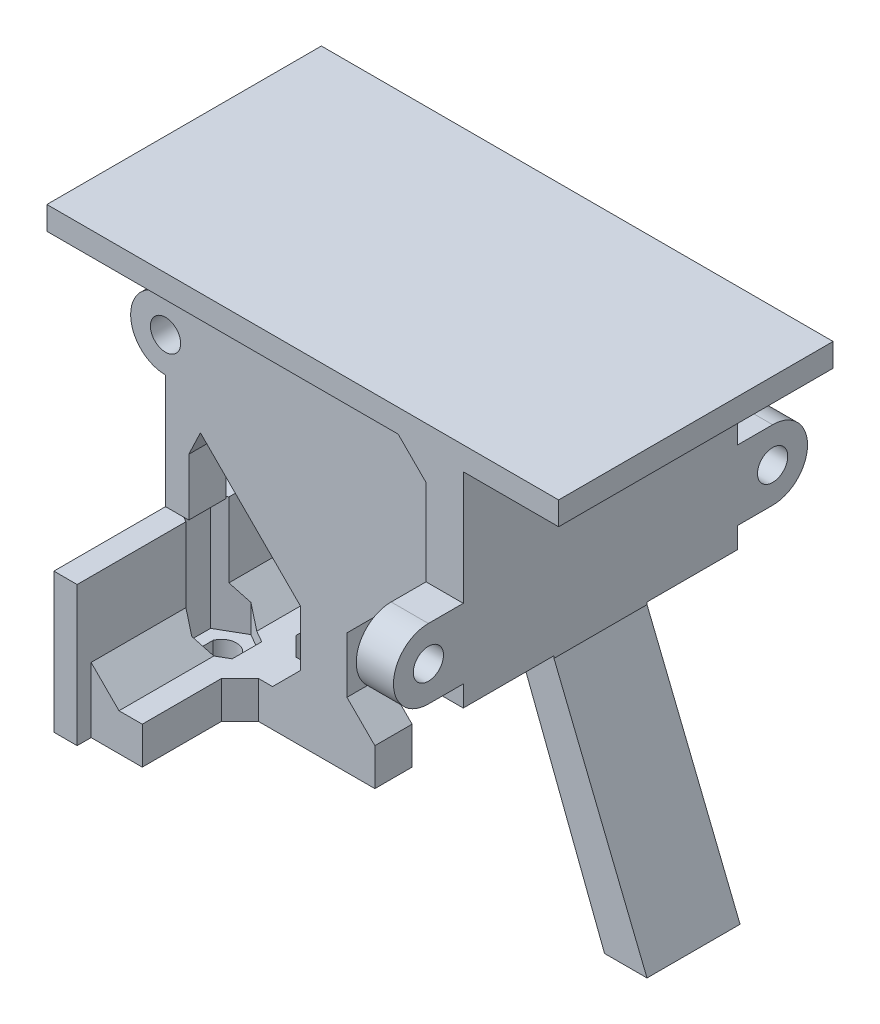
from build123d import *

# Parameters (mm, degrees)
CROQUIS1_R                   = 1.625
SALIENTE_EXTRUIR1_DEPTH      = 4
CROQUIS2_W                   = 5
CROQUIS2_H                   = 25
SALIENTE_EXTRUIR2_DEPTH      = 4
CROQUIS3_R                   = 1.625
SALIENTE_EXTRUIR3_DEPTH      = 4
CHAFL_N1_SIZE                = 3
CHAFL_N2_SIZE                = 1.5
SALIENTE_EXTRUIR4_DEPTH      = 21
SALIENTE_EXTRUIR4_DEPTH_BACK = 25
CROQUIS4_W                   = 7.75
CROQUIS4_H                   = 12
CORTAR_EXTRUIR1_DEPTH        = 52.798286651
CORTAR_EXTRUIR1_DEPTH_BACK   = 52.798286651
CROQUIS5_W                   = 3.75
CROQUIS5_H                   = 21
CORTAR_EXTRUIR2_DEPTH        = 48.697615244
CORTAR_EXTRUIR2_DEPTH_BACK   = 48.697615244
CROQUIS6_R                   = 1.625
CHAFL_N4_SIZE                = 5
CROQUIS7_R                   = 3.745
CORTAR_EXTRUIR5_DEPTH        = 22
CORTAR_EXTRUIR6_START        = 22
CROQUIS8_R                   = 3.745
CORTAR_EXTRUIR6_DEPTH        = 22
CORTAR_EXTRUIR7_DEPTH        = 22
CROQUIS10_R                  = 1.625
CORTAR_EXTRUIR8_DEPTH        = 22
CHAFL_N5_SIZE                = 12
CROQUIS11_W                  = 2.5
CROQUIS11_H                  = 28
SALIENTE_EXTRUIR5_DEPTH      = 15
CHAFL_N6_SIZE                = 3
CORTAR_EXTRUIR9_REACH        = 55.94
CORTAR_EXTRUIR9_START        = -2.5
CORTAR_EXTRUIR10_DEPTH       = 10
SALIENTE_EXTRUIR6_DEPTH      = 10
SALIENTE_EXTRUIR6_DEPTH_BACK = 8
CROQUIS14_W                  = 10
CROQUIS14_H                  = 25
CROQUIS15_W                  = 29.5
CROQUIS15_H                  = 4
CROQUIS15_W_2                = 4
CROQUIS15_H_2                = 29.5
SALIENTE_EXTRUIR7_DEPTH      = 10
CROQUIS16_W                  = 55
CROQUIS16_H                  = 29.5
SALIENTE_EXTRUIR8_DEPTH      = 2.5
CHAFL_N7_SIZE                = 3
SALIENTE_EXTRUIR9_DEPTH      = 4
CHAFL_N11_SIZE               = 3
CHAFL_N12_SIZE               = 10.100655646
CHAFL_N12_SIZE_2             = 25
CHAFL_N14_SIZE               = 35
CHAFL_N14_SIZE_2             = 13.435241226


# Some blends are built 0.0001 mm under size
with BuildPart() as part:
    # Croquis1 → Saliente-Extruir1 (new body)
    with BuildSketch(Plane.XY):
        with BuildLine():
            Line((-14.75, 6), (-14.75, 3.75))
            Line((-14.75, 3.75), (-18.5, 3.75))
            ThreePointArc((-18.5, 3.75), (-22.25, 0), (-18.5, -3.75))
            Line((-18.5, -3.75), (-14.75, -3.75))
            Line((-14.75, -3.75), (-14.75, -6))
            Line((-14.75, -6), (14.75, -6))
            Line((14.75, -6), (14.75, -3.75))
            Line((14.75, -3.75), (18.5, -3.75))
            ThreePointArc((18.5, -3.75), (22.25, 0), (18.5, 3.75))
            Line((18.5, 3.75), (14.75, 3.75))
            Line((14.75, 3.75), (14.75, 6))
            Line((14.75, 6), (-14.75, 6))
        make_face()
        with Locations((-18.5, 0)):
            Circle(CROQUIS1_R, mode=Mode.SUBTRACT)
        with Locations((18.5, 0)):
            Circle(CROQUIS1_R, mode=Mode.SUBTRACT)
    extrude(amount=SALIENTE_EXTRUIR1_DEPTH)

    # Croquis2 → Saliente-Extruir2 (add)
    with BuildSketch(Plane.XY.offset(4)):
        with Locations((-1.5, -18.5)):
            Rectangle(CROQUIS2_W, CROQUIS2_H)
    extrude(amount=-SALIENTE_EXTRUIR2_DEPTH)

    # Croquis3 → Saliente-Extruir3 (add)
    with BuildSketch(Plane.XZ.offset(31)):
        Polygon((-10.5, -1.5), (-10.5, -10.5), (-18.5, -10.5), (-18.5, 14.5), (-10.5, 14.5), (-10.5, 5.5), (4, 5.5), (4, -1.5), align=None)
        with Locations(Location((-14.5, 2, 0), (0, 0, 270))):
            Circle(CROQUIS3_R, mode=Mode.SUBTRACT)
    extrude(amount=-SALIENTE_EXTRUIR3_DEPTH)

    # Chaflán1
    chafl_n1_edges = [part.edges().sort_by_distance(p)[0] for p in [
        (-4, -27, 2),
    ]]
    chamfer(chafl_n1_edges, length=CHAFL_N1_SIZE)

    # Chaflán2
    chafl_n2_edges = [part.edges().sort_by_distance(p)[0] for p in [
        (-10.5, -29, -1.5),
        (-10.5, -29, 5.5),
    ]]
    chamfer(chafl_n2_edges, length=CHAFL_N2_SIZE)

    # Croquis4 → Saliente-Extruir4 (add, two sides: drawn at the far end of the back side and taken through both)
    with BuildSketch(Plane.XY.offset(4).offset(-SALIENTE_EXTRUIR4_DEPTH_BACK)):
        with Locations((22.375, 0)):
            Rectangle(CROQUIS4_W, CROQUIS4_H)
    extrude(amount=SALIENTE_EXTRUIR4_DEPTH + SALIENTE_EXTRUIR4_DEPTH_BACK)

    # Croquis5 → Cortar-Extruir1 (cut, two sides: drawn at the far end of the back side and taken through both)
    with BuildSketch(Plane(origin=(0, 6, 0), x_dir=(1, 0, 0), z_dir=(0, 1, 0)).offset(-CORTAR_EXTRUIR1_DEPTH_BACK)):
        with Locations((20.375, 10.5)):
            Rectangle(CROQUIS5_W, CROQUIS5_H)
        with Locations((20.375, -14.5)):
            Rectangle(CROQUIS5_W, CROQUIS5_H)
    extrude(amount=CORTAR_EXTRUIR1_DEPTH + CORTAR_EXTRUIR1_DEPTH_BACK, mode=Mode.SUBTRACT)

    # Croquis6 → Cortar-Extruir2 (cut, two sides: drawn at the far end of the back side and taken through both)
    with BuildSketch(Plane.XY.offset(4).offset(-CORTAR_EXTRUIR2_DEPTH_BACK)):
        with Locations((18.5, 0)):
            Circle(CROQUIS6_R)
        Polygon((18.5, 3.75), (22.25, 6), (18.5, 6), align=None)
        Polygon((18.5, -3.75), (22.25, -6), (18.5, -6), align=None)
    extrude(amount=CORTAR_EXTRUIR2_DEPTH + CORTAR_EXTRUIR2_DEPTH_BACK, mode=Mode.SUBTRACT)

    # Chaflán4
    # the kernel refuses this chamfer: 5 mm, written as the material it adds along each edge
    with BuildSketch(Plane(origin=(22.25, -6, 0), x_dir=(-0.9996219169112968, 0, 0.027495876610586372), z_dir=(0, 1, 0))) as chafl_n4_piece_1_section:
        Polygon((CHAFL_N4_SIZE * 0.999621916911, -CHAFL_N4_SIZE * 0.0274958766106), (-CHAFL_N4_SIZE * 0.0274958766106, -CHAFL_N4_SIZE * 0.999621916911), (0, 0), align=None)
    chafl_n4_piece_1 = extrude(amount=12, mode=Mode.PRIVATE)
    chafl_n4_piece_1 = split(chafl_n4_piece_1, bisect_by=Plane(origin=(20.922110661, -5.203266397, -2.017665357), z_dir=(0.5144957554275262, 0.8574929257125444, 0)), keep=Keep.TOP, mode=Mode.PRIVATE)
    chafl_n4_piece_1 = split(chafl_n4_piece_1, bisect_by=Plane(origin=(21.29244932, -3.75, -2.017665357), z_dir=(0, -1, 0)), keep=Keep.TOP, mode=Mode.PRIVATE)
    add(chafl_n4_piece_1)
    with BuildSketch(Plane(origin=(22.25, -6, 0), x_dir=(-0.9996219169112968, 0, 0.027495876610586372), z_dir=(0, 1, 0))) as chafl_n4_piece_2_section:
        Polygon((CHAFL_N4_SIZE * 0.999621916911, -CHAFL_N4_SIZE * 0.0274958766106), (-CHAFL_N4_SIZE * 0.0274958766106, -CHAFL_N4_SIZE * 0.999621916911), (0, 0), align=None)
    chafl_n4_piece_2 = extrude(amount=12, mode=Mode.PRIVATE)
    chafl_n4_piece_2 = split(chafl_n4_piece_2, bisect_by=Plane(origin=(17.859122077, -3.365473246, -0.159071565), z_dir=(-0.5144957554275262, -0.8574929257125444, 0)), keep=Keep.TOP, mode=Mode.PRIVATE)
    chafl_n4_piece_2 = split(chafl_n4_piece_2, bisect_by=Plane(origin=(17.761361038, -3.75, -0.159071565), z_dir=(0, 1, 0)), keep=Keep.TOP, mode=Mode.PRIVATE)
    add(chafl_n4_piece_2)
    with BuildSketch(Plane(origin=(22.25, -6, 0), x_dir=(-0.9996219169112968, 0, 0.027495876610586372), z_dir=(0, 1, 0))) as chafl_n4_piece_3_section:
        Polygon((CHAFL_N4_SIZE * 0.999621916911, -CHAFL_N4_SIZE * 0.0274958766106), (-CHAFL_N4_SIZE * 0.0274958766106, -CHAFL_N4_SIZE * 0.999621916911), (0, 0), align=None)
    chafl_n4_piece_3 = extrude(amount=12, mode=Mode.PRIVATE)
    chafl_n4_piece_3 = split(chafl_n4_piece_3, bisect_by=Plane(origin=(20.83228479, 3.75, -1.77005128), z_dir=(0, -1, 0)), keep=Keep.TOP, mode=Mode.PRIVATE)
    chafl_n4_piece_3 = split(chafl_n4_piece_3, bisect_by=Plane(origin=(18.560503744, 3.786302247, -1.77005128), z_dir=(0.5144957554275259, -0.8574929257125447, 0)), keep=Keep.TOP, mode=Mode.PRIVATE)
    chafl_n4_piece_3 = split(chafl_n4_piece_3, bisect_by=Plane(origin=(18.560503299, -3.786301979, -1.77005128), z_dir=(0.5144957554275262, 0.8574929257125444, 0)), keep=Keep.TOP, mode=Mode.PRIVATE)
    chafl_n4_piece_3 = split(chafl_n4_piece_3, bisect_by=Plane(origin=(20.83228479, -3.75, -1.77005128), z_dir=(0, 1, 0)), keep=Keep.TOP, mode=Mode.PRIVATE)
    chafl_n4_piece_3 = chafl_n4_piece_3 - Plane(origin=(18.5, 0, -1.77005128), x_dir=(1, 0, 0), z_dir=(0, 0, -1)) * Cylinder(1.625, 44, mode=Mode.PRIVATE)
    add(chafl_n4_piece_3)
    with BuildSketch(Plane(origin=(22.25, -6, 0), x_dir=(-0.9996219169112968, 0, 0.027495876610586372), z_dir=(0, 1, 0))) as chafl_n4_piece_4_section:
        Polygon((CHAFL_N4_SIZE * 0.999621916911, -CHAFL_N4_SIZE * 0.0274958766106), (-CHAFL_N4_SIZE * 0.0274958766106, -CHAFL_N4_SIZE * 0.999621916911), (0, 0), align=None)
    chafl_n4_piece_4 = extrude(amount=12, mode=Mode.PRIVATE)
    chafl_n4_piece_4 = split(chafl_n4_piece_4, bisect_by=Plane(origin=(21.29244932, 3.75, -2.017665357), z_dir=(0, 1, 0)), keep=Keep.TOP, mode=Mode.PRIVATE)
    chafl_n4_piece_4 = split(chafl_n4_piece_4, bisect_by=Plane(origin=(20.922110661, 5.203266397, -2.017665357), z_dir=(0.5144957554275259, -0.8574929257125447, 0)), keep=Keep.TOP, mode=Mode.PRIVATE)
    add(chafl_n4_piece_4)
    with BuildSketch(Plane(origin=(22.25, -6, 0), x_dir=(-0.9996219169112968, 0, 0.027495876610586372), z_dir=(0, 1, 0))) as chafl_n4_piece_5_section:
        Polygon((CHAFL_N4_SIZE * 0.999621916911, -CHAFL_N4_SIZE * 0.0274958766106), (-CHAFL_N4_SIZE * 0.0274958766106, -CHAFL_N4_SIZE * 0.999621916911), (0, 0), align=None)
    chafl_n4_piece_5 = extrude(amount=12, mode=Mode.PRIVATE)
    chafl_n4_piece_5 = split(chafl_n4_piece_5, bisect_by=Plane(origin=(17.761361038, 3.75, -0.159071565), z_dir=(0, -1, 0)), keep=Keep.TOP, mode=Mode.PRIVATE)
    chafl_n4_piece_5 = split(chafl_n4_piece_5, bisect_by=Plane(origin=(17.859122077, 3.365473246, -0.159071565), z_dir=(-0.5144957554275259, 0.8574929257125447, 0)), keep=Keep.TOP, mode=Mode.PRIVATE)
    add(chafl_n4_piece_5)
    with BuildSketch(Plane(origin=(22.25, 6, 4), x_dir=(-0.9996219169112968, 0, -0.027495876610586403), z_dir=(0, -1, 0))) as chafl_n4_piece_6_section:
        Polygon((CHAFL_N4_SIZE * 0.999621916911, -CHAFL_N4_SIZE * 0.0274958766106), (-CHAFL_N4_SIZE * 0.0274958766106, -CHAFL_N4_SIZE * 0.999621916911), (0, 0), align=None)
    chafl_n4_piece_6 = extrude(amount=12, mode=Mode.PRIVATE)
    chafl_n4_piece_6 = split(chafl_n4_piece_6, bisect_by=Plane(origin=(21.29244932, 3.75, 6.017665357), z_dir=(0, 1, 0)), keep=Keep.TOP, mode=Mode.PRIVATE)
    chafl_n4_piece_6 = split(chafl_n4_piece_6, bisect_by=Plane(origin=(20.922110661, 5.203266397, 6.017665357), z_dir=(0.5144957554275259, -0.8574929257125447, 0)), keep=Keep.TOP, mode=Mode.PRIVATE)
    add(chafl_n4_piece_6)
    with BuildSketch(Plane(origin=(22.25, 6, 4), x_dir=(-0.9996219169112968, 0, -0.027495876610586403), z_dir=(0, -1, 0))) as chafl_n4_piece_7_section:
        Polygon((CHAFL_N4_SIZE * 0.999621916911, -CHAFL_N4_SIZE * 0.0274958766106), (-CHAFL_N4_SIZE * 0.0274958766106, -CHAFL_N4_SIZE * 0.999621916911), (0, 0), align=None)
    chafl_n4_piece_7 = extrude(amount=12, mode=Mode.PRIVATE)
    chafl_n4_piece_7 = split(chafl_n4_piece_7, bisect_by=Plane(origin=(17.761361038, 3.75, 4.159071565), z_dir=(0, -1, 0)), keep=Keep.TOP, mode=Mode.PRIVATE)
    chafl_n4_piece_7 = split(chafl_n4_piece_7, bisect_by=Plane(origin=(17.859122077, 3.365473246, 4.159071565), z_dir=(-0.5144957554275259, 0.8574929257125447, 0)), keep=Keep.TOP, mode=Mode.PRIVATE)
    add(chafl_n4_piece_7)
    with BuildSketch(Plane(origin=(22.25, 6, 4), x_dir=(-0.9996219169112968, 0, -0.027495876610586403), z_dir=(0, -1, 0))) as chafl_n4_piece_8_section:
        Polygon((CHAFL_N4_SIZE * 0.999621916911, -CHAFL_N4_SIZE * 0.0274958766106), (-CHAFL_N4_SIZE * 0.0274958766106, -CHAFL_N4_SIZE * 0.999621916911), (0, 0), align=None)
    chafl_n4_piece_8 = extrude(amount=12, mode=Mode.PRIVATE)
    chafl_n4_piece_8 = split(chafl_n4_piece_8, bisect_by=Plane(origin=(20.832284794, 3.75, 5.770051284), z_dir=(0, -1, 0)), keep=Keep.TOP, mode=Mode.PRIVATE)
    chafl_n4_piece_8 = split(chafl_n4_piece_8, bisect_by=Plane(origin=(18.560503747, 3.786302248, 5.770051284), z_dir=(0.5144957554275259, -0.8574929257125447, 0)), keep=Keep.TOP, mode=Mode.PRIVATE)
    chafl_n4_piece_8 = split(chafl_n4_piece_8, bisect_by=Plane(origin=(18.560503303, -3.786301982, 5.770051284), z_dir=(0.5144957554275262, 0.8574929257125444, 0)), keep=Keep.TOP, mode=Mode.PRIVATE)
    chafl_n4_piece_8 = split(chafl_n4_piece_8, bisect_by=Plane(origin=(20.832284794, -3.75, 5.770051284), z_dir=(0, 1, 0)), keep=Keep.TOP, mode=Mode.PRIVATE)
    chafl_n4_piece_8 = chafl_n4_piece_8 - Plane(origin=(18.5, 0, 5.770051284), x_dir=(1, 0, 0), z_dir=(0, 0, -1)) * Cylinder(1.625, 44, mode=Mode.PRIVATE)
    add(chafl_n4_piece_8)
    with BuildSketch(Plane(origin=(22.25, 6, 4), x_dir=(-0.9996219169112968, 0, -0.027495876610586403), z_dir=(0, -1, 0))) as chafl_n4_piece_9_section:
        Polygon((CHAFL_N4_SIZE * 0.999621916911, -CHAFL_N4_SIZE * 0.0274958766106), (-CHAFL_N4_SIZE * 0.0274958766106, -CHAFL_N4_SIZE * 0.999621916911), (0, 0), align=None)
    chafl_n4_piece_9 = extrude(amount=12, mode=Mode.PRIVATE)
    chafl_n4_piece_9 = split(chafl_n4_piece_9, bisect_by=Plane(origin=(20.922110661, -5.203266397, 6.017665357), z_dir=(0.5144957554275262, 0.8574929257125444, 0)), keep=Keep.TOP, mode=Mode.PRIVATE)
    chafl_n4_piece_9 = split(chafl_n4_piece_9, bisect_by=Plane(origin=(21.29244932, -3.75, 6.017665357), z_dir=(0, -1, 0)), keep=Keep.TOP, mode=Mode.PRIVATE)
    add(chafl_n4_piece_9)
    with BuildSketch(Plane(origin=(22.25, 6, 4), x_dir=(-0.9996219169112968, 0, -0.027495876610586403), z_dir=(0, -1, 0))) as chafl_n4_piece_10_section:
        Polygon((CHAFL_N4_SIZE * 0.999621916911, -CHAFL_N4_SIZE * 0.0274958766106), (-CHAFL_N4_SIZE * 0.0274958766106, -CHAFL_N4_SIZE * 0.999621916911), (0, 0), align=None)
    chafl_n4_piece_10 = extrude(amount=12, mode=Mode.PRIVATE)
    chafl_n4_piece_10 = split(chafl_n4_piece_10, bisect_by=Plane(origin=(17.859122077, -3.365473246, 4.159071565), z_dir=(-0.5144957554275262, -0.8574929257125444, 0)), keep=Keep.TOP, mode=Mode.PRIVATE)
    chafl_n4_piece_10 = split(chafl_n4_piece_10, bisect_by=Plane(origin=(17.761361038, -3.75, 4.159071565), z_dir=(0, 1, 0)), keep=Keep.TOP, mode=Mode.PRIVATE)
    add(chafl_n4_piece_10)

    # Croquis7 → Cortar-Extruir5 (cut)
    with BuildSketch(Plane.XY.offset(4)):
        with Locations((18.5, 0)):
            Circle(CROQUIS7_R)
    extrude(amount=CORTAR_EXTRUIR5_DEPTH, mode=Mode.SUBTRACT)

    # Croquis8 → Cortar-Extruir6 (cut)
    with BuildSketch(Plane(origin=(0, 0, 0), x_dir=(-1, 0, 0), z_dir=(0, 0, -1)).offset(CORTAR_EXTRUIR6_START)):
        with Locations((-18.5, 0)):
            Circle(CROQUIS8_R)
    extrude(amount=-CORTAR_EXTRUIR6_DEPTH, mode=Mode.SUBTRACT)

    # Croquis9 → Cortar-Extruir7 (cut)
    with BuildSketch(Plane(origin=(26.25, 0, 0), x_dir=(0, 0, -1), z_dir=(1, 0, 0))):
        with BuildLine():
            Line((-16.75, 6), (-16.75, 3.75))
            Line((-16.75, 3.75), (-20.5, 3.75))
            ThreePointArc((-20.5, 3.75), (-24.25, 0), (-20.5, -3.75))
            Line((-20.5, -3.75), (-16.75, -3.75))
            Line((-16.75, -3.75), (-16.75, -6))
            Line((-16.75, -6), (-25, -6))
            Line((-25, -6), (-25, 6))
            Line((-25, 6), (-16.75, 6))
        make_face()
        with BuildLine():
            Line((12.75, -6), (12.75, -3.75))
            Line((12.75, -3.75), (16.5, -3.75))
            ThreePointArc((16.5, -3.75), (20.25, 0), (16.5, 3.75))
            Line((16.5, 3.75), (12.75, 3.75))
            Line((12.75, 3.75), (12.75, 6))
            Line((12.75, 6), (21, 6))
            Line((21, 6), (21, -6))
            Line((21, -6), (12.75, -6))
        make_face()
    extrude(amount=-CORTAR_EXTRUIR7_DEPTH, mode=Mode.SUBTRACT)

    # Croquis10 → Cortar-Extruir8 (cut)
    with BuildSketch(Plane(origin=(26.25, 0, 0), x_dir=(0, 0, -1), z_dir=(1, 0, 0))):
        with Locations((-20.5, 0)):
            Circle(CROQUIS10_R)
        with Locations((16.5, 0)):
            Circle(CROQUIS10_R)
    extrude(amount=-CORTAR_EXTRUIR8_DEPTH, mode=Mode.SUBTRACT)

    # Chaflán5
    # the kernel refuses this chamfer: 12 mm, written as the material it adds along each edge
    with BuildSketch(Plane(origin=(-4, -6, 4), x_dir=(0.02749587661058656, -0.9996219169112968, 0), z_dir=(0, 0, -1))) as chafl_n5_piece_1_section:
        Polygon((CHAFL_N5_SIZE * 0.999621916911, CHAFL_N5_SIZE * 0.0274958766106), (-CHAFL_N5_SIZE * 0.0274958766106, CHAFL_N5_SIZE * 0.999621916911), (0, 0), align=None)
    chafl_n5_piece_1 = extrude(amount=4, mode=Mode.PRIVATE)
    chafl_n5_piece_1 = split(chafl_n5_piece_1, bisect_by=Plane(origin=(-14.75, -10.034768689, 2), z_dir=(1, 0, 0)), keep=Keep.TOP, mode=Mode.PRIVATE)
    add(chafl_n5_piece_1)
    with BuildSketch(Plane(origin=(1, -6, 4), x_dir=(-0.027495876610586226, -0.9996219169112968, 0), z_dir=(0, 0, -1))) as chafl_n5_piece_2:
        Polygon((CHAFL_N5_SIZE * 0.999621916911, -CHAFL_N5_SIZE * 0.0274958766106), (-CHAFL_N5_SIZE * 0.0274958766106, -CHAFL_N5_SIZE * 0.999621916911), (0, 0), align=None)
    extrude(amount=4)

    # Croquis11 → Saliente-Extruir5 (add)
    with BuildSketch(Plane.XZ.offset(31)):
        with Locations((-17.25, 2)):
            Rectangle(CROQUIS11_W, CROQUIS11_H)
    extrude(amount=-SALIENTE_EXTRUIR5_DEPTH)

    # Chaflán6
    chafl_n6_edges = [part.edges().sort_by_distance(p)[0] for p in [
        (-16, -27, -4.5625),
        (-16, -27, 8.5625),
    ]]
    chamfer(chafl_n6_edges, length=CHAFL_N6_SIZE)

    # Cortar-Extruir9: up to this face of the body (flat: up to its plane)
    cortar_extruir9_end = Plane(part.part.faces().sort_by_distance((-17.25, -16, 2))[0])
    # Croquis12 → Cortar-Extruir9 (cut, up to the picked face)
    with BuildSketch(Plane.XZ.offset(31).offset(CORTAR_EXTRUIR9_START), mode=Mode.PRIVATE) as cortar_extruir9_sk1:
        Polygon((-11.75, 0.41228676), (-11.75, 3.58771324), (-14.5, 5.175426481), (-17.25, 3.58771324), (-17.25, 0.41228676), (-14.5, -1.175426481), align=None)
    cortar_extruir9_tool1 = split(extrude(cortar_extruir9_sk1.sketch, amount=-CORTAR_EXTRUIR9_REACH, mode=Mode.PRIVATE), bisect_by=cortar_extruir9_end, keep=Keep.BOTH, mode=Mode.PRIVATE)
    add(cortar_extruir9_tool1.solids().sort_by(Axis((-14.5, -28.5, 2), (0, 1, 0)))[0], mode=Mode.SUBTRACT)

    # Croquis13 → Cortar-Extruir10 (cut)
    with BuildSketch(Plane(origin=(0, -27, 0), x_dir=(1, 0, 0), z_dir=(0, 1, 0))):
        Polygon((-10.5, 3), (-10.5, 2), (-8.5, 0), (4, 0), (4, 5.164967874), align=None)
        Polygon((4, -9.164967874), (-10.5, -7), (-10.5, -6), (-8.5, -4), (4, -4), align=None)
    extrude(amount=-CORTAR_EXTRUIR10_DEPTH, mode=Mode.SUBTRACT)

    # Croquis14 → Saliente-Extruir6 (add, two sides: drawn at the far end of the back side and taken through both)
    with BuildSketch(Plane(origin=(26.25, 0, 0), x_dir=(0, 0, -1), z_dir=(1, 0, 0)).offset(-SALIENTE_EXTRUIR6_DEPTH_BACK)):
        with Locations((-2, -18.5)):
            Rectangle(CROQUIS14_W, CROQUIS14_H)
    extrude(amount=SALIENTE_EXTRUIR6_DEPTH + SALIENTE_EXTRUIR6_DEPTH_BACK)

    # Croquis15 → Saliente-Extruir7 (add)
    with BuildSketch(Plane(origin=(0, 6, 0), x_dir=(1, 0, 0), z_dir=(0, 1, 0))):
        with Locations((0, -2)):
            Rectangle(CROQUIS15_W, CROQUIS15_H)
        with Locations((24.25, -2)):
            Rectangle(CROQUIS15_W_2, CROQUIS15_H_2)
    extrude(amount=SALIENTE_EXTRUIR7_DEPTH)

    # Croquis16 → Saliente-Extruir8 (add)
    with BuildSketch(Plane(origin=(0, 16, 0), x_dir=(1, 0, 0), z_dir=(0, 1, 0))):
        with Locations((9, -2)):
            Rectangle(CROQUIS16_W, CROQUIS16_H)
    extrude(amount=SALIENTE_EXTRUIR8_DEPTH)

    # Chaflán7
    chafl_n7_edges = [part.edges().sort_by_distance(p)[0] for p in [
        (-14.75, 16, 2),
        (14.75, 16, 2),
        (22.25, 16, 2),
    ]]
    chamfer(chafl_n7_edges, length=CHAFL_N7_SIZE)

    # Croquis17 → Saliente-Extruir9 (add)
    with BuildSketch(Plane.XY.offset(4)):
        Polygon((-18.5, -16), (-18.5, -3.75), (-14.75, -3.75), (-14.75, -7.25), (-16, -9.875), (-16, -16), align=None)
    extrude(amount=-SALIENTE_EXTRUIR9_DEPTH)

    # Chaflán11
    chafl_n11_edges = [part.edges().sort_by_distance(p)[0] for p in [
        (1, -27, 2),
    ]]
    chamfer(chafl_n11_edges, length=CHAFL_N11_SIZE - 0.0001)  # a hair under: the kernel refuses the full size

    # Chaflán12
    # the kernel refuses this chamfer: 25, 10.100655646 mm, written as the material it takes off along each edge
    with BuildSketch(Plane(origin=(36.25, -6, 71.824724871), x_dir=(-0.9961057015681394, 0.08816706473193467, 0), z_dir=(0, 0, -1))) as chafl_n12_piece_1_section:
        Polygon((CHAFL_N12_SIZE * 0.996105701556, -CHAFL_N12_SIZE * 0.0881670647309), (-CHAFL_N12_SIZE_2 * 0.0881670647319, -CHAFL_N12_SIZE_2 * 0.996105701568), (0, 0), align=None)
    chafl_n12_piece_1 = extrude(amount=139.649449741, mode=Mode.PRIVATE)
    chafl_n12_piece_1 = split(chafl_n12_piece_1, bisect_by=Plane(origin=(26.25, -14.541402501, 2), z_dir=(1, 0, 0)), keep=Keep.TOP, mode=Mode.PRIVATE)
    add(chafl_n12_piece_1, mode=Mode.SUBTRACT)

    # Chaflán14
    # the kernel refuses this chamfer: 35, 13.435241226 mm, written as the material it takes off along each edge
    with BuildSketch(Plane(origin=(18.25, -31, -93.776197383), x_dir=(-0.013817364679015908, 0.9999045356599435, 0), z_dir=(0, 0, 1))) as chafl_n14_piece_1_section:
        Polygon((CHAFL_N14_SIZE * 0.99990453566, -CHAFL_N14_SIZE * 0.013817364679), (-CHAFL_N14_SIZE_2 * 0.0138173646793, -CHAFL_N14_SIZE_2 * 0.999904535678), (0, 0), align=None)
    chafl_n14_piece_1 = extrude(amount=191.552394765, mode=Mode.PRIVATE)
    chafl_n14_piece_1 = split(chafl_n14_piece_1, bisect_by=Plane(origin=(18.916666667, -6, -2.333333333), z_dir=(0, -1, 0)), keep=Keep.TOP, mode=Mode.PRIVATE)
    add(chafl_n14_piece_1, mode=Mode.SUBTRACT)


solid = part.part
